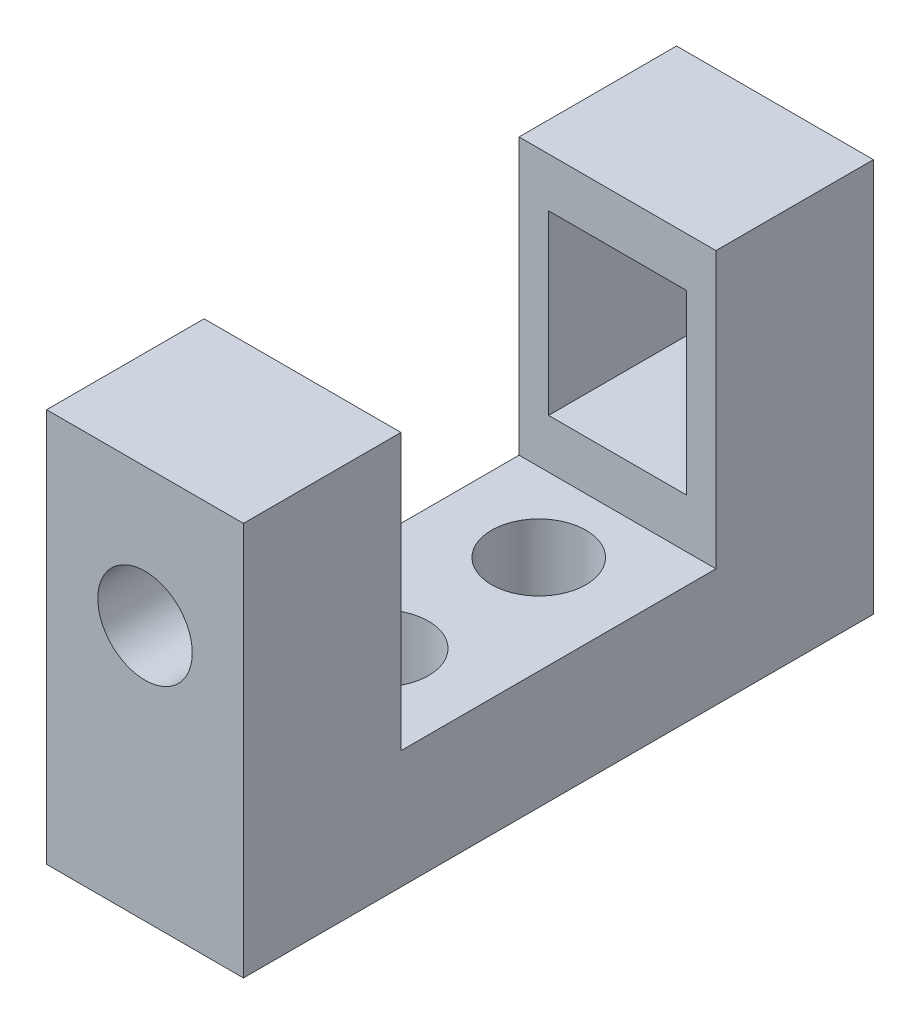
from build123d import *

# Parameters (mm, degrees)
SKETCH1_W                 = 5
SKETCH1_H                 = 7
BOSS_EXTRUDE1_DEPTH       = 2
BOSS_EXTRUDE3_DEPTH       = 3
SKETCH13_W                = 5
SKETCH13_H                = 4
BOSS_EXTRUDE4_DEPTH       = 7
SKETCH14_W                = 4
SKETCH14_H                = 4
BOSS_EXTRUDE6_DEPTH       = 3
FILLET1_R                 = 2.5
M2_CLEARANCE_HOLE3_REACH  = 20.453
M2_CLEARANCE_HOLE3_BORE_R = 1.2
SKETCH15_W                = 3.5
SKETCH15_H                = 4.5
CUT_EXTRUDE1_DEPTH        = 4
M2_CLEARANCE_HOLE2_D      = 2.4
M2_CLEARANCE_HOLE2_DEPTH  = 4
M2_CLEARANCE_HOLE2_TIP    = 0.721032743
SKETCH22_W                = 4
SKETCH22_H                = 16
CUT_EXTRUDE2_DEPTH        = 3


with BuildPart() as part:
    # Sketch1 → Boss-Extrude1 (new, symmetric)
    with BuildSketch(Plane.XY):
        Rectangle(SKETCH1_W, SKETCH1_H)
    extrude(amount=BOSS_EXTRUDE1_DEPTH, both=True)

    # Sketch9 → Boss-Extrude3 (add)
    with BuildSketch(Plane.XZ.offset(3.5)):
        Polygon((2.5, 2), (6.5, 2), (6.5, -2), (2.5, -2), (-2.5, -2), (-2.5, 2), (-2.5, 14), (2.5, 14), align=None)
    extrude(amount=BOSS_EXTRUDE3_DEPTH)

    # Sketch13 → Boss-Extrude4 (add)
    with BuildSketch(Plane(origin=(0, -3.5, 0), x_dir=(1, 0, 0), z_dir=(0, 1, 0))):
        with Locations((0, -12)):
            Rectangle(SKETCH13_W, SKETCH13_H)
    extrude(amount=BOSS_EXTRUDE4_DEPTH)

    # Sketch14 → Boss-Extrude6 (add)
    with BuildSketch(Plane(origin=(0, -3.5, 0), x_dir=(1, 0, 0), z_dir=(0, 1, 0))):
        with Locations((4.5, -12)):
            Rectangle(SKETCH14_W, SKETCH14_H)
    extrude(amount=-BOSS_EXTRUDE6_DEPTH)

    # Fillet1
    # the kernel refuses this fillet: 2.5 mm, written as the material it adds along each edge
    with BuildSketch(Plane(origin=(2.5, -3.5, 2), x_dir=(0, 0, 1), z_dir=(0, -1, 0))) as fillet1_piece_1:
        with BuildLine():
            CenterArc((FILLET1_R, -FILLET1_R), FILLET1_R, 90, 90)
            Line((0, -FILLET1_R), (0, 0))
            Line((0, 0), (FILLET1_R, 0))
        make_face()
    extrude(amount=3)
    with BuildSketch(Plane(origin=(2.5, -3.5, 10), x_dir=(0, 0, -1), z_dir=(0, -1, 0))) as fillet1_piece_2:
        with BuildLine():
            CenterArc((FILLET1_R, FILLET1_R), FILLET1_R, 180, 90)
            Line((0, FILLET1_R), (0, 0))
            Line((0, 0), (FILLET1_R, 0))
        make_face()
    extrude(amount=3)

    # M2 Clearance Hole3 bore → M2 Clearance Hole3 (cut, up to next)
    with BuildSketch(Plane.XY.offset(14), mode=Mode.PRIVATE) as m2_clearance_hole3_sk1:
        Circle(M2_CLEARANCE_HOLE3_BORE_R)
    m2_clearance_hole3_tool1 = extrude(m2_clearance_hole3_sk1.sketch, amount=-M2_CLEARANCE_HOLE3_REACH, mode=Mode.PRIVATE) & part.part
    add(m2_clearance_hole3_tool1.solids().sort_by_distance((0, 0, 14))[0], mode=Mode.SUBTRACT)

    # Sketch15 → Cut-Extrude1 (cut)
    with BuildSketch(Plane(origin=(0, 0, -2), x_dir=(-1, 0, 0), z_dir=(0, 0, -1))):
        Rectangle(SKETCH15_W, SKETCH15_H)
    extrude(amount=-CUT_EXTRUDE1_DEPTH, mode=Mode.SUBTRACT)

    # M2 Clearance Hole2
    with Locations(Plane(origin=(0, -3.5, 0), x_dir=(1, 0, 0), z_dir=(0, 1, 0))):
        with Locations((4.5, -12), (0, -8), (0, -4), (4.5, 0)):
            Hole(M2_CLEARANCE_HOLE2_D / 2, depth=M2_CLEARANCE_HOLE2_DEPTH)
            with Locations((0, 0, -(M2_CLEARANCE_HOLE2_DEPTH + M2_CLEARANCE_HOLE2_TIP / 2))):  # 118° drill point
                Cone(0, M2_CLEARANCE_HOLE2_D / 2, M2_CLEARANCE_HOLE2_TIP, mode=Mode.SUBTRACT)

    # Sketch22 → Cut-Extrude2 (cut)
    with BuildSketch(Plane(origin=(0, -3.5, 0), x_dir=(1, 0, 0), z_dir=(0, 1, 0))):
        with Locations((4.5, -6)):
            Rectangle(SKETCH22_W, SKETCH22_H)
    extrude(amount=-CUT_EXTRUDE2_DEPTH, mode=Mode.SUBTRACT)


solid = part.part
